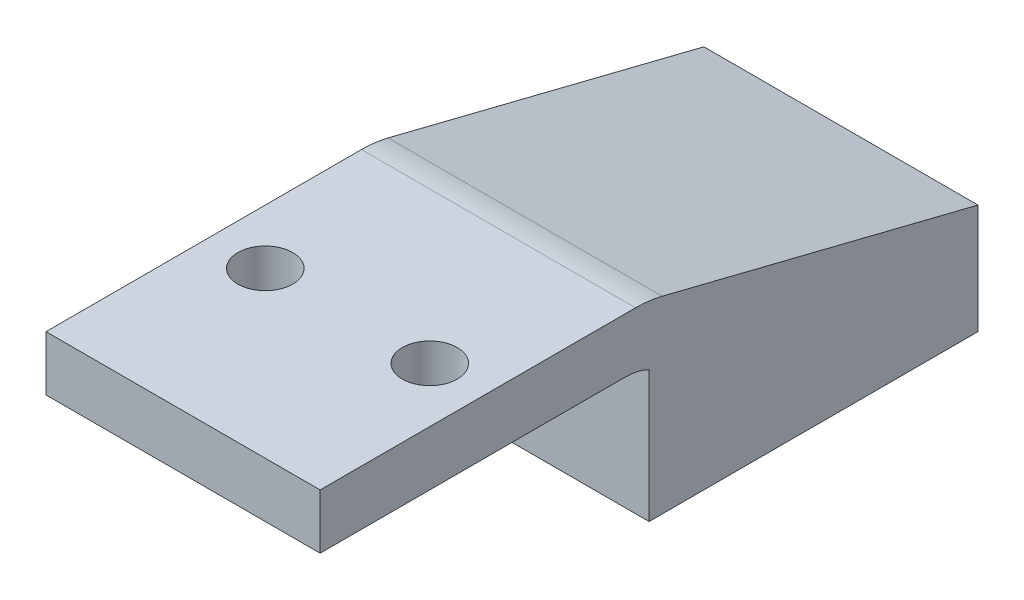
from build123d import *

# Parameters (mm, degrees)
SKETCH1_W           = 60
SKETCH1_H           = 20
SKETCH1_H_2         = 10
BOSS_EXTRUDE1_DEPTH = 50
FILLET1_R           = 20
BOSS_EXTRUDE2_DEPTH = 50
FILLET2_R           = 10
BOSS_EXTRUDE3_DEPTH = 20
FILLET3_R           = 5
SKETCH4_R           = 5
CUT_EXTRUDE1_DEPTH  = 10


with BuildPart() as part:
    # Sketch1 → Boss-Extrude1 (new body)
    with BuildSketch(Plane(origin=(0, 0, 0), x_dir=(0, 0, -1), z_dir=(1, 0, 0))):
        Rectangle(SKETCH1_W, SKETCH1_H)
        Polygon((-30, 25), (30, 10), (-30, 10), align=None)
        with Locations((-60, 20)):
            Rectangle(SKETCH1_W, SKETCH1_H_2)
    extrude(amount=BOSS_EXTRUDE1_DEPTH)

    # Fillet1
    fillet1_edges = [part.edges().sort_by_distance(p)[0] for p in [
        (25, 25, 30),
    ]]
    fillet(fillet1_edges, radius=FILLET1_R)

    # Sketch2 → Boss-Extrude2 (add)
    with BuildSketch(Plane.ZY):
        Polygon((30, 15), (30, 14), (31, 15), align=None)
    extrude(amount=-BOSS_EXTRUDE2_DEPTH)

    # Fillet2
    # the kernel refuses this fillet: 10 mm, written as the material it adds along each edge
    with BuildSketch(Plane(origin=(0, 15, 31), x_dir=(0, 0, 1), z_dir=(1, 0, 0))) as fillet2_piece_1:
        with BuildLine():
            CenterArc((3.358898944, 10), FILLET2_R, 244.158067237, 25.841932763)
            Line((-1, 1), (-1.087177979, 0.82))
            ThreePointArc((-1.087177979, 0.82), (-0.641421356, 0.358578644), (-0.141421356, -0.141421356))
            Line((-0.141421356, -0.141421356), (0, -0.2))
            Line((0, -0.2), (3.358898944, -0.2))
            Line((3.358898944, -0.2), (3.358898944, 0))
        make_face()
    extrude(amount=50)

    # Sketch3 → Boss-Extrude3 (add)
    with BuildSketch(Plane(origin=(0, 0, -30), x_dir=(-1, 0, 0), z_dir=(0, 0, -1))):
        with BuildLine():
            Line((-5.55, -10), (-11.149999969, -10))
            ThreePointArc((-11.149999969, -10), (-7.543755405, -11.493755427), (-6.05, -15.1))
            Line((-6.05, -15.1), (-5.55, -15.1))
            Line((-5.55, -15.1), (-5.55, -10))
        make_face()
        with BuildLine():
            Line((-16.75, -15.1), (-16.25, -15.1))
            ThreePointArc((-16.25, -15.1), (-14.756244573, -11.493755405), (-11.149999969, -10))
            Line((-11.149999969, -10), (-16.75, -10))
            Line((-16.75, -10), (-16.75, -15.1))
        make_face()
    extrude(amount=-BOSS_EXTRUDE3_DEPTH)

    # Fillet3
    fillet3_edges = [part.edges().sort_by_distance(p)[0] for p in [
        (5.55, -10, -20),
        (16.75, -10, -20),
    ]]
    fillet(fillet3_edges, radius=FILLET3_R)

    # Sketch4 → Cut-Extrude1 (cut)
    with BuildSketch(Plane(origin=(0, 25, 0), x_dir=(1, 0, 0), z_dir=(0, 1, 0))):
        with Locations(Location((10, -60, 0), (0, 0, 270))):
            Circle(SKETCH4_R)
        with Locations(Location((40, -60, 0), (0, 0, 270))):
            Circle(SKETCH4_R)
    extrude(amount=-CUT_EXTRUDE1_DEPTH, mode=Mode.SUBTRACT)


solid = part.part
